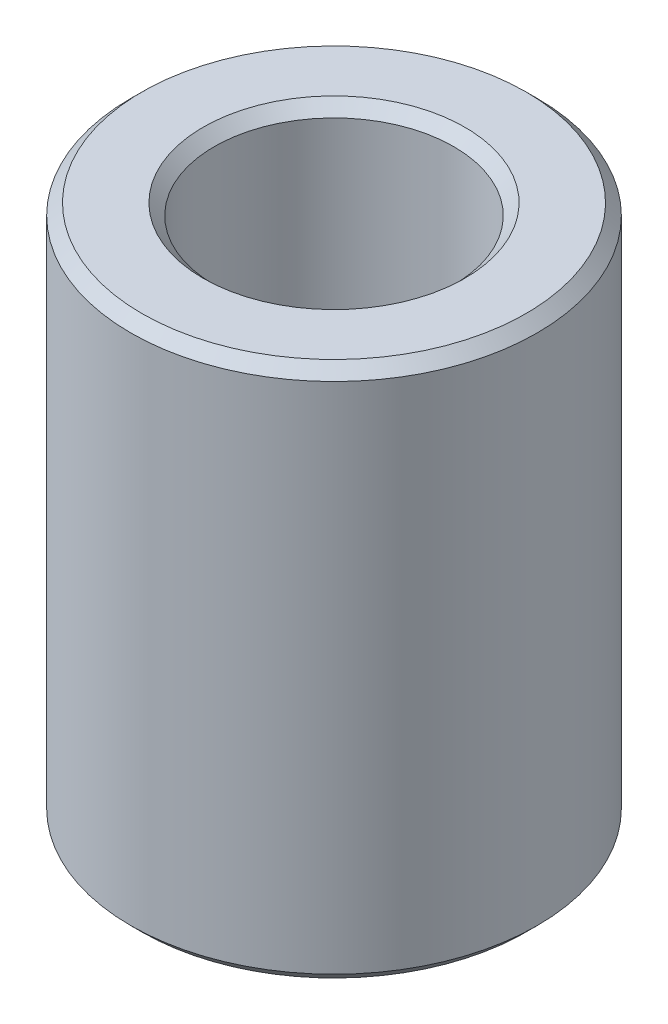
from build123d import *

# Parameters (mm, degrees)
SKETCH1_R           = 37.5
BOSS_EXTRUDE1_DEPTH = 98.856056997
SKETCH2_R           = 22.092748623
CUT_EXTRUDE1_DEPTH  = 113.182975558
CHAMFER1_SIZE       = 2.063768304


with BuildPart() as part:
    # Sketch1 → Boss-Extrude1 (new body)
    with BuildSketch(Plane(origin=(0, 0, 0), x_dir=(1, 0, 0), z_dir=(0, 1, 0))):
        Circle(SKETCH1_R)
    extrude(amount=BOSS_EXTRUDE1_DEPTH)

    # Sketch2 → Cut-Extrude1 (cut, through all)
    with BuildSketch(Plane(origin=(0, 0, 0), x_dir=(1, 0, 0), z_dir=(0, 1, 0))):
        Circle(SKETCH2_R)
    extrude(amount=CUT_EXTRUDE1_DEPTH, mode=Mode.SUBTRACT)

    # Chamfer1
    chamfer1_edges = [part.edges().sort_by_distance(p)[0] for p in [
        (-22.092748623, 98.856056997, 0),
        (-22.092748623, 0, 0),
        (-37.5, 0, 0),
        (-37.5, 98.856056997, 0),
    ]]
    chamfer(chamfer1_edges, length=CHAMFER1_SIZE)


solid = part.part
